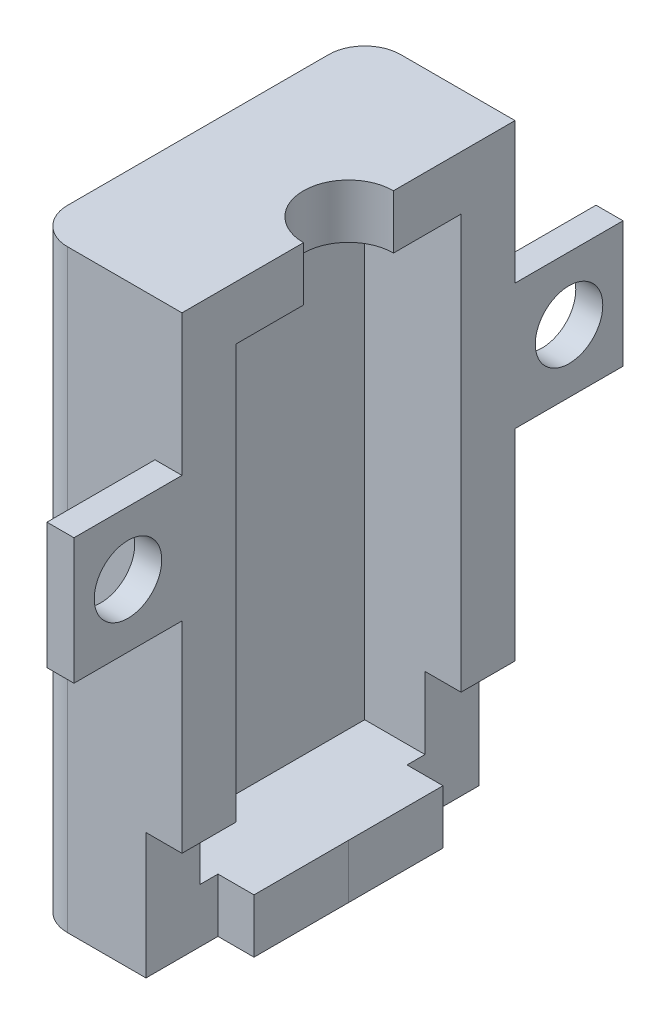
from build123d import *

# Parameters (mm, degrees)
SKETCH1_W           = 16.7
SKETCH1_H           = 18.5
BOSS_EXTRUDE1_DEPTH = 3
SKETCH2_W           = 16.7
SKETCH2_H           = 18.5
SKETCH2_W_2         = 10.7
SKETCH2_H_2         = 12.5
BOSS_EXTRUDE2_DEPTH = 27
SKETCH7_W           = 4
SKETCH7_H           = 8
CUT_EXTRUDE1_DEPTH  = 7
SKETCH9_W           = 16.7
SKETCH9_H           = 18.5
BOSS_EXTRUDE3_DEPTH = 3
SKETCH10_R          = 2.5
CUT_EXTRUDE2_DEPTH  = 3
FILLET1_R           = 2
SKETCH11_W          = 3
SKETCH11_H          = 7
BOSS_EXTRUDE4_DEPTH = 6
SKETCH12_R          = 1.875
CUT_EXTRUDE3_DEPTH  = 6
CUT_EXTRUDE4_START  = -33
CUT_EXTRUDE4_DEPTH  = 33


# Read off the part's stored shape, not the designer's step: Cut-Extrude4
with BuildPart() as part:
    # Sketch1 → Boss-Extrude1 (new body)
    with BuildSketch(Plane(origin=(0, 0, 0), x_dir=(1, 0, 0), z_dir=(0, 1, 0))):
        Rectangle(SKETCH1_W, SKETCH1_H)
    extrude(amount=BOSS_EXTRUDE1_DEPTH)

    # Sketch2 → Boss-Extrude2 (add)
    with BuildSketch(Plane(origin=(0, 3, 0), x_dir=(1, 0, 0), z_dir=(0, 1, 0))):
        Rectangle(SKETCH2_W, SKETCH2_H)
        Rectangle(SKETCH2_W_2, SKETCH2_H_2, mode=Mode.SUBTRACT)
    extrude(amount=BOSS_EXTRUDE2_DEPTH)

    # Sketch7 → Cut-Extrude1 (cut)
    with BuildSketch(Plane.XZ):
        with Locations((0, 9.25)):
            Rectangle(SKETCH7_W, SKETCH7_H)
        with Locations((0, -9.25)):
            Rectangle(SKETCH7_W, SKETCH7_H)
    extrude(amount=-CUT_EXTRUDE1_DEPTH, mode=Mode.SUBTRACT)

    # Sketch9 → Boss-Extrude3 (add)
    with BuildSketch(Plane(origin=(0, 30, 0), x_dir=(1, 0, 0), z_dir=(0, 1, 0))):
        Rectangle(SKETCH9_W, SKETCH9_H)
    extrude(amount=BOSS_EXTRUDE3_DEPTH)

    # Sketch10 → Cut-Extrude2 (cut)
    with BuildSketch(Plane(origin=(0, 33, 0), x_dir=(1, 0, 0), z_dir=(0, 1, 0))):
        with Locations(Location((0, 0, 0), (0, 0, 270))):
            Circle(SKETCH10_R)
    extrude(amount=-CUT_EXTRUDE2_DEPTH, mode=Mode.SUBTRACT)

    # Fillet1
    fillet1_edges = [part.edges().sort_by_distance(p)[0] for p in [
        (8.35, 16.5, 9.25),
        (-8.35, 16.5, 9.25),
        (-8.35, 16.5, -9.25),
        (8.35, 16.5, -9.25),
    ]]
    fillet(fillet1_edges, radius=FILLET1_R)

    # Sketch11 → Boss-Extrude4 (add)
    with BuildSketch(Plane.XY.offset(9.25)):
        with Locations((0, 21.679413475)):
            Rectangle(SKETCH11_W, SKETCH11_H)
    boss_extrude4 = extrude(amount=BOSS_EXTRUDE4_DEPTH)

    # Sketch12 → Cut-Extrude3 (cut)
    with BuildSketch(Plane(origin=(1.5, 0, 0), x_dir=(0, 0, -1), z_dir=(1, 0, 0))):
        with Locations(Location((-12.25, 21.679413475, 0), (0, 0, 90))):
            Circle(SKETCH12_R)
    cut_extrude3 = extrude(amount=-CUT_EXTRUDE3_DEPTH, mode=Mode.SUBTRACT)

    # Mirror1: Boss-Extrude4, Cut-Extrude3 across plane
    add(boss_extrude4.mirror(Plane.XY))
    add(cut_extrude3.mirror(Plane.XY), mode=Mode.SUBTRACT)

    # Cut-Extrude4 outline → Cut-Extrude4 (cut)
    with BuildSketch(Plane(origin=(0, 33, 0), x_dir=(1, 0, 0), z_dir=(0, 1, 0)).offset(CUT_EXTRUDE4_START)):
        with BuildLine():
            Line((0, -15.25), (1.5, -15.25))
            Line((1.5, -15.25), (1.5, -9.25))
            Line((1.5, -9.25), (6.35, -9.25))
            ThreePointArc((6.35, -9.25), (7.764213562, -8.664213562), (8.35, -7.25))
            Line((8.35, -7.25), (8.35, 7.25))
            ThreePointArc((8.35, 7.25), (7.764213562, 8.664213562), (6.35, 9.25))
            Line((6.35, 9.25), (1.5, 9.25))
            Line((1.5, 9.25), (1.5, 15.25))
            Line((1.5, 15.25), (0, 15.25))
            Line((0, 15.25), (0, -15.25))
        make_face()
    extrude(amount=CUT_EXTRUDE4_DEPTH, mode=Mode.SUBTRACT)


solid = part.part
